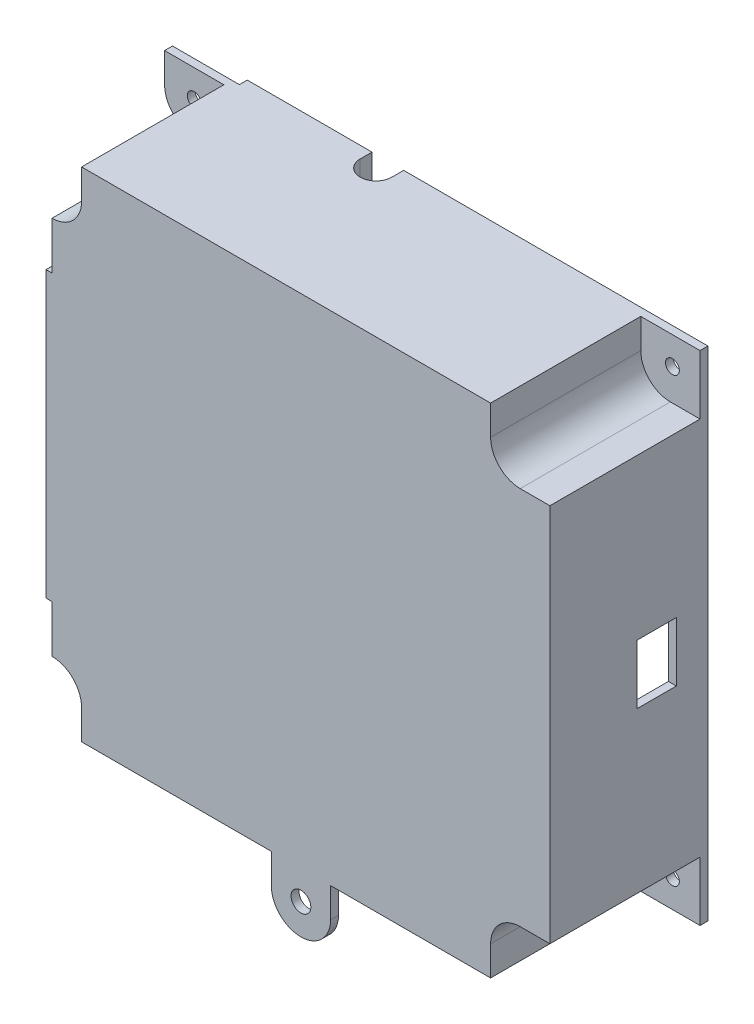
from build123d import *

# Parameters (mm, degrees)
ESQUISSE1_W                          = 126
ESQUISSE1_H                          = 126
BOSS_EXTRU_1_DEPTH                   = 40
ENL_V_MAT_EXTRU_1_DEPTH              = 38
ENL_V_MAT_EXTRU_2_REACH              = 223.428
ESQUISSE4_R                          = 1.75
ENL_V_MAT_EXTRU_5_DEPTH              = 36
COQUE1_DEPTH                         = 38
COQUE1_2_DEPTH                       = 2
BOSS_EXTRU_3_DEPTH                   = 2
ENL_V_MAT_EXTRU_6_REACH              = 228.297
ESQUISSE13_R                         = 1.75
ENL_V_MAT_EXTRU_14_DEPTH             = 2
ESQUISSE16_W                         = 40
ESQUISSE16_H                         = 72
ENL_V_MAT_EXTRU_9_DEPTH              = 2
BOSS_EXTRU_5_DEPTH                   = 2
ENL_V_MAT_EXTRU_11_REACH             = 228.968
ESQUISSE21_R                         = 2.5
ESQUISSE23_R                         = 3
BOSS_EXTRU_7_DEPTH                   = 10
ESQUISSE24_R                         = 1
ENL_V_MAT_EXTRU_12_DEPTH             = 9
R_P_TITION_LIN_AIRE1_COUNT           = 2
R_P_TITION_LIN_AIRE1_PITCH           = 25
R_P_TITION_LIN_AIRE2_COUNT           = 2
R_P_TITION_LIN_AIRE2_PITCH           = 52
R_P_TITION_LIN_AIRE2_COPY_1_SKETCH_R = 3
R_P_TITION_LIN_AIRE2_COPY_1_DEPTH    = 10
R_P_TITION_LIN_AIRE2_COPY_2_SKETCH_R = 1
R_P_TITION_LIN_AIRE2_COPY_2_DEPTH    = 9
ENL_V_MAT_EXTRU_13_REACH             = 211.939
ESQUISSE25_W                         = 10
ESQUISSE25_H                         = 15
ESQUISSE28_W                         = 2
ESQUISSE28_H                         = 72
BOSS_EXTRU_8_DEPTH                   = 3.5
ESQUISSE30_W                         = 20
ESQUISSE30_H                         = 5
BOSS_EXTRU_9_DEPTH                   = 38
ENL_V_MAT_EXTRU_15_REACH             = 218.201


# Read off the part's stored shape, not the designer's step: Coque1
with BuildPart() as part:
    # Esquisse1 → Boss.-Extru.1 (new body)
    with BuildSketch(Plane.XY):
        with Locations((-88.440384558, 94.010362694)):
            Rectangle(ESQUISSE1_W, ESQUISSE1_H)
    extrude(amount=BOSS_EXTRU_1_DEPTH)

    # Esquisse2 → Enlèv. mat.-Extru.1 (cut)
    with BuildSketch(Plane.XY.offset(40)):
        with BuildLine():
            Line((-40.440384558, 31.010362694), (-25.440384558, 31.010362694))
            Line((-25.440384558, 31.010362694), (-25.440384558, 46.010362694))
            Line((-25.440384558, 46.010362694), (-32.940384558, 46.010362694))
            ThreePointArc((-32.940384558, 46.010362694), (-38.243685417, 43.813663553), (-40.440384558, 38.510362694))
            Line((-40.440384558, 38.510362694), (-40.440384558, 31.010362694))
        make_face()
    enl_v_mat_extru_1 = extrude(amount=-ENL_V_MAT_EXTRU_1_DEPTH, mode=Mode.SUBTRACT)

    # Esquisse4 → Enlèv. mat.-Extru.2 (cut, up to next)
    with BuildSketch(Plane.XY.offset(2), mode=Mode.PRIVATE) as enl_v_mat_extru_2_sk1:
        with Locations((-32.440384558, 38.010362694)):
            Circle(ESQUISSE4_R)
    enl_v_mat_extru_2_tool1 = extrude(enl_v_mat_extru_2_sk1.sketch, amount=-ENL_V_MAT_EXTRU_2_REACH, mode=Mode.PRIVATE) & part.part
    enl_v_mat_extru_2 = enl_v_mat_extru_2_tool1.solids().sort_by_distance((-32.440385, 38.010363, 2))[0]
    add(enl_v_mat_extru_2, mode=Mode.SUBTRACT)

    # Symétrie1: Enlèv. mat.-Extru.1, Enlèv. mat.-Extru.2 across plane
    add(enl_v_mat_extru_1.mirror(Plane(origin=(0, 94.010362694, 0), x_dir=(0, 0, 1), z_dir=(0, -1, 0))), mode=Mode.SUBTRACT)
    add(enl_v_mat_extru_2.mirror(Plane(origin=(0, 94.010362694, 0), x_dir=(0, 0, 1), z_dir=(0, -1, 0))), mode=Mode.SUBTRACT)

    # Esquisse10 → Enlèv. mat.-Extru.5 (cut)
    with BuildSketch(Plane.XY.offset(40)):
        with BuildLine():
            Line((-151.440384558, 46.010362694), (-151.440384558, 31.010362694))
            Line((-151.440384558, 31.010362694), (-143.940384558, 31.010362694))
            Line((-143.940384558, 31.010362694), (-143.940384558, 38.510362694))
            ThreePointArc((-143.940384558, 38.510362694), (-146.137083699, 43.813663553), (-151.440384558, 46.010362694))
        make_face()
    enl_v_mat_extru_5 = extrude(amount=-ENL_V_MAT_EXTRU_5_DEPTH, mode=Mode.SUBTRACT)

    # Symétrie3: Enlèv. mat.-Extru.5 across plane
    add(enl_v_mat_extru_5.mirror(Plane(origin=(0, 94.010362694, 0), x_dir=(0, 0, 1), z_dir=(0, -1, 0))), mode=Mode.SUBTRACT)

    # Coque1 outline → Coque1 (cut)
    with BuildSketch(Plane.XY):
        with BuildLine():
            Line((-42.440384558, 155.010362694), (-141.940384558, 155.010362694))
            Line((-141.940384558, 155.010362694), (-141.940384558, 149.510362694))
            ThreePointArc((-141.940384558, 149.510362694), (-144.049511808, 143.541694501), (-149.440384558, 140.223274884))
            Line((-149.440384558, 140.223274884), (-149.440384558, 47.797450505))
            ThreePointArc((-149.440384558, 47.797450505), (-144.049511808, 44.479030887), (-141.940384558, 38.510362694))
            Line((-141.940384558, 38.510362694), (-141.940384558, 33.010362694))
            Line((-141.940384558, 33.010362694), (-42.440384558, 33.010362694))
            Line((-42.440384558, 33.010362694), (-42.440384558, 38.510362694))
            ThreePointArc((-42.440384558, 38.510362694), (-39.657898979, 45.227877116), (-32.940384558, 48.010362694))
            Line((-32.940384558, 48.010362694), (-27.440384558, 48.010362694))
            Line((-27.440384558, 48.010362694), (-27.440384558, 140.010362694))
            Line((-27.440384558, 140.010362694), (-32.940384558, 140.010362694))
            ThreePointArc((-32.940384558, 140.010362694), (-39.657898979, 142.792848273), (-42.440384558, 149.510362694))
            Line((-42.440384558, 149.510362694), (-42.440384558, 155.010362694))
        make_face()
    extrude(amount=COQUE1_DEPTH, mode=Mode.SUBTRACT)

    # Coque1 2 outline → Coque1 2 (cut)
    with BuildSketch(Plane.XY):
        with BuildLine():
            Line((-141.940384558, 155.010362694), (-149.440384558, 155.010362694))
            Line((-149.440384558, 155.010362694), (-149.440384558, 140.223274884))
            ThreePointArc((-149.440384558, 140.223274884), (-144.049511808, 143.541694501), (-141.940384558, 149.510362694))
            Line((-141.940384558, 149.510362694), (-141.940384558, 155.010362694))
        make_face()
        with BuildLine():
            ThreePointArc((-141.940384558, 38.510362694), (-144.049511808, 44.479030887), (-149.440384558, 47.797450505))
            Line((-149.440384558, 47.797450505), (-149.440384558, 33.010362694))
            Line((-149.440384558, 33.010362694), (-141.940384558, 33.010362694))
            Line((-141.940384558, 33.010362694), (-141.940384558, 38.510362694))
        make_face()
    extrude(amount=COQUE1_2_DEPTH, mode=Mode.SUBTRACT)

    # Esquisse12 → Boss.-Extru.3 (add)
    with BuildSketch(Plane.XY.offset(4)):
        with BuildLine():
            Line((-158.940384558, 31.010362694), (-158.940384558, 38.510362694))
            ThreePointArc((-158.940384558, 38.510362694), (-156.743685417, 43.813663553), (-151.440384558, 46.010362694))
            Line((-151.440384558, 46.010362694), (-151.440384558, 31.010362694))
            Line((-151.440384558, 31.010362694), (-158.940384558, 31.010362694))
        make_face()
    boss_extru_3 = extrude(amount=-BOSS_EXTRU_3_DEPTH)

    # Esquisse13 → Enlèv. mat.-Extru.6 (cut, up to next)
    with BuildSketch(Plane.XY.offset(4), mode=Mode.PRIVATE) as enl_v_mat_extru_6_sk1:
        with Locations((-151.440384558, 38.010362694)):
            Circle(ESQUISSE13_R)
    enl_v_mat_extru_6_tool1 = extrude(enl_v_mat_extru_6_sk1.sketch, amount=-ENL_V_MAT_EXTRU_6_REACH, mode=Mode.PRIVATE) & part.part
    enl_v_mat_extru_6 = enl_v_mat_extru_6_tool1.solids().sort_by_distance((-151.440385, 38.010363, 4))[0]
    add(enl_v_mat_extru_6, mode=Mode.SUBTRACT)

    # Esquisse27 → Enlèv. mat.-Extru.14 (cut)
    with BuildSketch(Plane(origin=(0, 0, 0), x_dir=(-1, 0, 0), z_dir=(0, 0, -1))):
        Polygon((149.440384558, 33.010362694), (149.440384558, 48.141426507), (151.440384558, 48.141426507), (151.440384558, 31.010362694), (142.02307923, 31.010362694), (142.041179779, 33.010362694), align=None)
    enl_v_mat_extru_14 = extrude(amount=-ENL_V_MAT_EXTRU_14_DEPTH, mode=Mode.SUBTRACT)

    # Symétrie5: Boss.-Extru.3, Enlèv. mat.-Extru.6, Enlèv. mat.-Extru.14 across plane
    add(boss_extru_3.mirror(Plane(origin=(0, 94.010362694, 0), x_dir=(0, 0, 1), z_dir=(0, -1, 0))))
    add(enl_v_mat_extru_6.mirror(Plane(origin=(0, 94.010362694, 0), x_dir=(0, 0, 1), z_dir=(0, -1, 0))), mode=Mode.SUBTRACT)
    add(enl_v_mat_extru_14.mirror(Plane(origin=(0, 94.010362694, 0), x_dir=(0, 0, 1), z_dir=(0, -1, 0))), mode=Mode.SUBTRACT)

    # Esquisse16 → Enlèv. mat.-Extru.9 (cut)
    with BuildSketch(Plane.ZY.offset(151.440384558)):
        with Locations((20, 94.010362694)):
            Rectangle(ESQUISSE16_W, ESQUISSE16_H)
    extrude(amount=-ENL_V_MAT_EXTRU_9_DEPTH, mode=Mode.SUBTRACT)

    # Esquisse20 → Boss.-Extru.5 (add)
    with BuildSketch(Plane.XY.offset(40)):
        with BuildLine():
            Line((-80.940384558, 31.010362694), (-95.940384558, 31.010362694))
            Line((-95.940384558, 31.010362694), (-95.940384558, 23.510362694))
            ThreePointArc((-95.940384558, 23.510362694), (-88.440384558, 16.010362694), (-80.940384558, 23.510362694))
            Line((-80.940384558, 23.510362694), (-80.940384558, 31.010362694))
        make_face()
    extrude(amount=-BOSS_EXTRU_5_DEPTH)

    # Esquisse21 → Enlèv. mat.-Extru.11 (cut, up to next)
    with BuildSketch(Plane.XY.offset(40), mode=Mode.PRIVATE) as enl_v_mat_extru_11_sk1:
        with Locations((-88.440384558, 23.760362694)):
            Circle(ESQUISSE21_R)
    enl_v_mat_extru_11_tool1 = extrude(enl_v_mat_extru_11_sk1.sketch, amount=-ENL_V_MAT_EXTRU_11_REACH, mode=Mode.PRIVATE) & part.part
    add(enl_v_mat_extru_11_tool1.solids().sort_by_distance((-88.440385, 23.760363, 40))[0], mode=Mode.SUBTRACT)

    # Esquisse23 → Boss.-Extru.7 (add)
    with BuildSketch(Plane(origin=(0, 0, 38), x_dir=(-1, 0, 0), z_dir=(0, 0, -1))):
        with Locations(Location((40.440384558, 81.010362694, 0), (0, 0, 180))):
            Circle(ESQUISSE23_R)
    boss_extru_7 = extrude(amount=BOSS_EXTRU_7_DEPTH)

    # Esquisse24 → Enlèv. mat.-Extru.12 (cut)
    with BuildSketch(Plane(origin=(0, 0, 28), x_dir=(-1, 0, 0), z_dir=(0, 0, -1))):
        with Locations((40.440384558, 81.010362694)):
            Circle(ESQUISSE24_R)
    enl_v_mat_extru_12 = extrude(amount=-ENL_V_MAT_EXTRU_12_DEPTH, mode=Mode.SUBTRACT)

    # Répétition linéaire1: Boss.-Extru.7, Enlèv. mat.-Extru.12 ×2
    with Locations(*[(0, i * R_P_TITION_LIN_AIRE1_PITCH, 0) for i in range(1, R_P_TITION_LIN_AIRE1_COUNT)]):
        add(boss_extru_7)
        add(enl_v_mat_extru_12, mode=Mode.SUBTRACT)

    # Répétition linéaire2: Boss.-Extru.7, Enlèv. mat.-Extru.12 ×2
    with Locations(*[(-i * R_P_TITION_LIN_AIRE2_PITCH, 0, 0) for i in range(1, R_P_TITION_LIN_AIRE2_COUNT)]):
        add(boss_extru_7)
        add(enl_v_mat_extru_12, mode=Mode.SUBTRACT)

    # Répétition linéaire2 copy 1 sketch → Répétition linéaire2 copy 1 (add)
    with BuildSketch(Plane(origin=(-52, 25, 38), x_dir=(-1, 0, 0), z_dir=(0, 0, -1))):
        with Locations(Location((40.440384558, 81.010362694, 0), (0, 0, 180))):
            Circle(R_P_TITION_LIN_AIRE2_COPY_1_SKETCH_R)
    extrude(amount=R_P_TITION_LIN_AIRE2_COPY_1_DEPTH)

    # Répétition linéaire2 copy 2 sketch → Répétition linéaire2 copy 2 (cut)
    with BuildSketch(Plane(origin=(-52, 25, 28), x_dir=(-1, 0, 0), z_dir=(0, 0, -1))):
        with Locations((40.440384558, 81.010362694)):
            Circle(R_P_TITION_LIN_AIRE2_COPY_2_SKETCH_R)
    extrude(amount=-R_P_TITION_LIN_AIRE2_COPY_2_DEPTH, mode=Mode.SUBTRACT)

    # Esquisse25 → Enlèv. mat.-Extru.13 (cut, up to next)
    with BuildSketch(Plane(origin=(-25.440384558, 0, 0), x_dir=(0, 0, -1), z_dir=(1, 0, 0)), mode=Mode.PRIVATE) as enl_v_mat_extru_13_sk1:
        with Locations((-13, 94.010362694)):
            Rectangle(ESQUISSE25_W, ESQUISSE25_H)
    enl_v_mat_extru_13_tool1 = extrude(enl_v_mat_extru_13_sk1.sketch, amount=-ENL_V_MAT_EXTRU_13_REACH, mode=Mode.PRIVATE) & part.part
    add(enl_v_mat_extru_13_tool1.solids().sort_by_distance((-25.440385, 94.010363, 13))[0], mode=Mode.SUBTRACT)

    # Esquisse28 → Boss.-Extru.8 (add)
    with BuildSketch(Plane.ZY.offset(149.440384558)):
        with Locations((39, 94.010362694)):
            Rectangle(ESQUISSE28_W, ESQUISSE28_H)
    extrude(amount=BOSS_EXTRU_8_DEPTH)

    # Esquisse30 → Boss.-Extru.9 (add)
    with BuildSketch(Plane(origin=(0, 0, 38), x_dir=(-1, 0, 0), z_dir=(0, 0, -1))):
        with Locations((106.440384558, 152.510362694)):
            Rectangle(ESQUISSE30_W, ESQUISSE30_H)
    extrude(amount=BOSS_EXTRU_9_DEPTH)

    # Esquisse29 → Enlèv. mat.-Extru.15 (cut, up to next)
    with BuildSketch(Plane(origin=(0, 157.010362694, 0), x_dir=(1, 0, 0), z_dir=(0, 1, 0)), mode=Mode.PRIVATE) as enl_v_mat_extru_15_sk1:
        with BuildLine():
            Line((-110.440384558, -3), (-110.440384558, 0))
            Line((-110.440384558, 0), (-102.440384558, 0))
            Line((-102.440384558, 0), (-102.440384558, -3))
            ThreePointArc((-102.440384558, -3), (-106.440384558, -7), (-110.440384558, -3))
        make_face()
    enl_v_mat_extru_15_tool1 = extrude(enl_v_mat_extru_15_sk1.sketch, amount=-ENL_V_MAT_EXTRU_15_REACH, mode=Mode.PRIVATE) & part.part
    add(enl_v_mat_extru_15_tool1.solids().sort_by_distance((-106.440385, 157.010363, 3.135687))[0], mode=Mode.SUBTRACT)


solid = part.part
